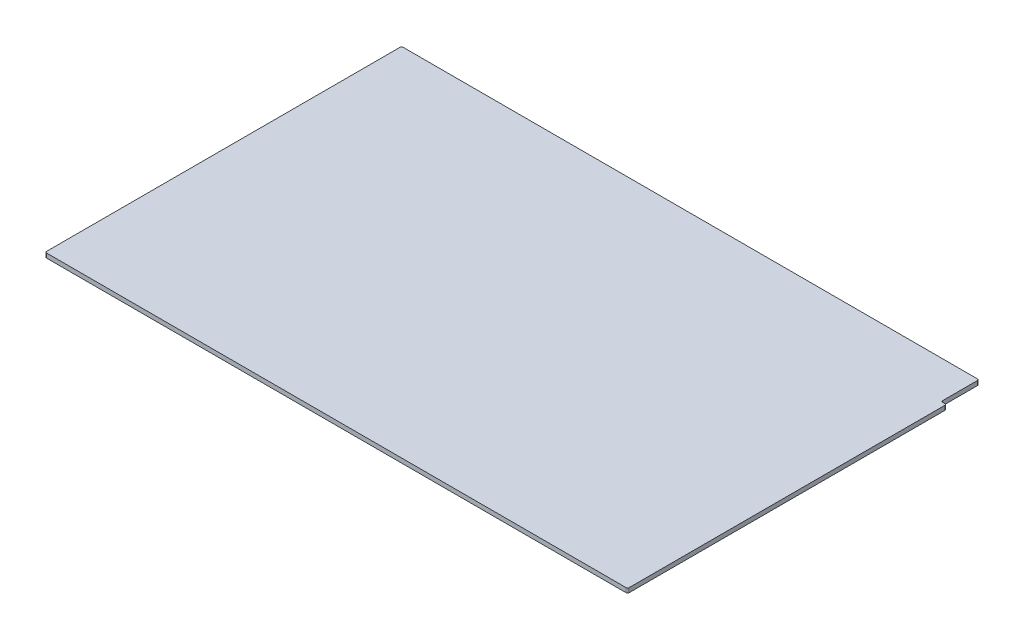
from build123d import *

# Parameters (mm, degrees)
SKETCH1_W          = 156.8958
SKETCH1_H          = 96.012
BASE_FLANGE1_DEPTH = 1.1938
SKETCH6_W          = 1.397
SKETCH6_H          = 10.16
CUT_EXTRUDE1_DEPTH = 184.945702206
FILLET1_R          = 0.396875


# Sheet-metal steps are written as plain solids
with BuildPart() as part:
    # Sketch1 → Base-Flange1 (new body)
    with BuildSketch(Plane(origin=(0, 0, 0), x_dir=(1, 0, 0), z_dir=(0, 1, 0))):
        with Locations((78.4479, 48.006)):
            Rectangle(SKETCH1_W, SKETCH1_H)
    extrude(amount=-BASE_FLANGE1_DEPTH)

    # Sketch6 → Cut-Extrude1 (cut, through all)
    with BuildSketch(Plane(origin=(0, 0, 0), x_dir=(1, 0, 0), z_dir=(0, 1, 0))):
        with Locations((156.1973, 90.932)):
            Rectangle(SKETCH6_W, SKETCH6_H)
    extrude(amount=-CUT_EXTRUDE1_DEPTH, mode=Mode.SUBTRACT)

    # Fillet1
    fillet1_edges = [part.edges().sort_by_distance(p)[0] for p in [
        (156.8958, -0.5969, -85.852),
        (155.4988, -0.5969, -85.852),
        (155.4988, -0.5969, -96.012),
        (0, -0.5969, 0),
        (0, -0.5969, -96.012),
        (156.8958, -0.5969, 0),
    ]]
    fillet(fillet1_edges, radius=FILLET1_R)


solid = part.part
